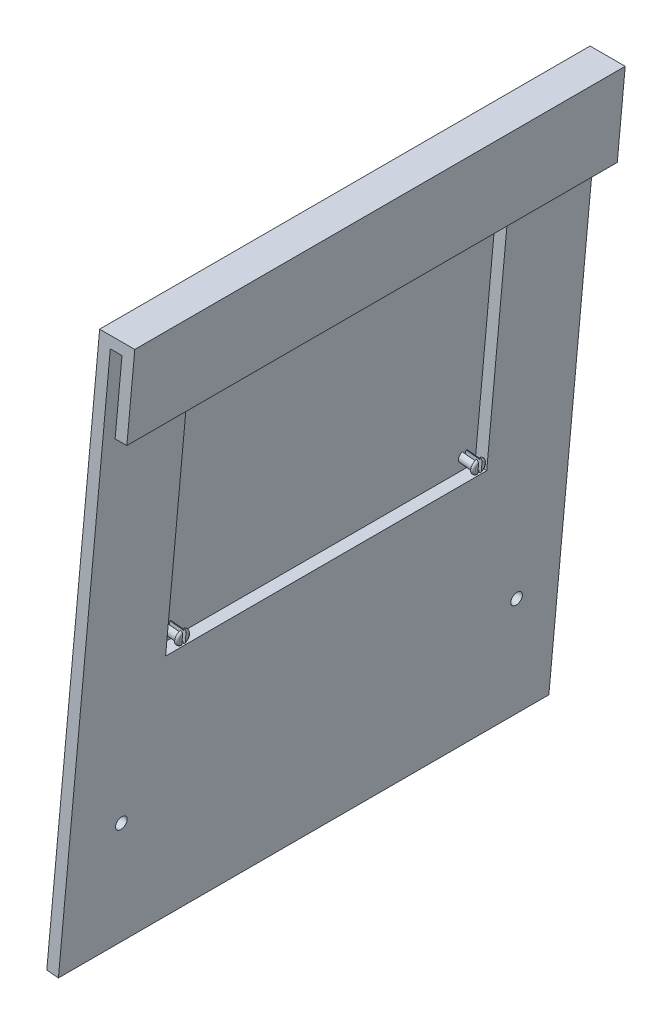
from build123d import *

# Parameters (mm, degrees)
CORTE_EXTRUS_O1_DEPTH      = 14
CORTE_EXTRUS_O1_DEPTH_BACK = 717.203128827
ESBO_O5_W                  = 275
ESBO_O5_H                  = 214
ESBO_O4_W                  = 300
ESBO_O4_H                  = 240
RESSALTO_EXTRUS_O1_DEPTH   = 15.25
ESBO_O6_R                  = 4.5
RESSALTO_EXTRUS_O2_DEPTH   = 12
ESBO_O7_R                  = 6
RESSALTO_EXTRUS_O3_DEPTH   = 2
FILETE1_R                  = 2
CORTE_EXTRUS_O2_REACH      = 717.754
ESBO_O8_W                  = 3
ESBO_O8_H                  = 13.7577121
ESBO_O8_H_2                = 16.639730047
ESBO_O8_H_3                = 15.770394444
ESBO_O8_H_4                = 13.946137119
CORTE_EXTRUS_O3_DEPTH      = 717.203128827
CORTE_EXTRUS_O3_DEPTH_BACK = 717.203128827
ESBO_O9_W                  = 197.593358125
ESBO_O9_H                  = 578.666263081
ESBO_O9_W_2                = 155.251924241
FILETE2_R                  = 5
SKETCH1_R                  = 5
CUT_EXTRUDE1_DEPTH         = 10
SKETCH2_R                  = 5
CUT_EXTRUDE2_DEPTH         = 10
SKETCH3_R                  = 5
CUT_EXTRUDE3_DEPTH         = 10
SKETCH4_R                  = 5
CUT_EXTRUDE4_DEPTH         = 10


with BuildPart() as part:
    # Varredura2: sweep along a path in Esboço2
    with BuildLine(Plane(origin=(0, 550, 0), x_dir=(1, 0, 0), z_dir=(0, 1, 0))) as varredura2_path:
        Line((950, -255), (950, 255))
    # Esboço3 → Varredura2 (sweep)
    with BuildSketch(Plane.XY):
        Polygon((942.163647796, 573.800125755), (952.163647796, 573.800125755), (946.282557752, 509.10813527), (956.32379504, 509.10813527), (963.113975993, 583.800125755), (933.031501417, 583.800125755), (887.763628395, 85.853522521), (897.72256046, 84.948165061), align=None)
    sweep(path=varredura2_path.line)

    # Esboço5 → Corte-extrusão1 (cut, two sides: drawn at the far end of the back side and taken through both)
    with BuildSketch(Plane(origin=(872.745985968, -79.340544179, 0), x_dir=(0, 0, 1), z_dir=(-0.995893206467704, 0.09053574604251849, 0)).offset(-CORTE_EXTRUS_O1_DEPTH_BACK)):
        with Locations((0, 485.875282236)):
            Rectangle(ESBO_O5_W, ESBO_O5_H)
    extrude(amount=CORTE_EXTRUS_O1_DEPTH + CORTE_EXTRUS_O1_DEPTH_BACK, mode=Mode.SUBTRACT)

    # Esboço4 → Ressalto-extrusão1 (add)
    with BuildSketch(Plane(origin=(872.745985968, -79.340544179, 0), x_dir=(0, 0, 1), z_dir=(-0.995893206467704, 0.09053574604251849, 0))):
        with Locations((0, 485.875282236)):
            Rectangle(ESBO_O4_W, ESBO_O4_H)
    extrude(amount=RESSALTO_EXTRUS_O1_DEPTH)

    # Esboço6 → Ressalto-extrusão2 (add)
    with BuildSketch(Plane(origin=(872.745985968, -79.340544179, 0), x_dir=(0, 0, -1), z_dir=(0.995893206467704, -0.09053574604251843, 0))):
        with Locations(Location((-126.74, 389.535282236, 0), (0, 0, 90))):
            Circle(ESBO_O6_R)
        with Locations(Location((126.74, 389.535282236, 0), (0, 0, 270))):
            Circle(ESBO_O6_R)
        with Locations(Location((-126.74, 581.525282236, 0), (0, 0, 90))):
            Circle(ESBO_O6_R)
        with Locations(Location((126.74, 581.525282236, 0), (0, 0, 270))):
            Circle(ESBO_O6_R)
    extrude(amount=RESSALTO_EXTRUS_O2_DEPTH)

    # Esboço7 → Ressalto-extrusão3 (add)
    with BuildSketch(Plane(origin=(884.696704446, -80.426973131, 0), x_dir=(0, 0, -1), z_dir=(0.995893206467704, -0.09053574604251846, 0))):
        with Locations(Location((-126.74, 389.535282236, 0), (0, 0, 90))):
            Circle(ESBO_O7_R)
        with Locations(Location((126.74, 389.535282236, 0), (0, 0, 90))):
            Circle(ESBO_O7_R)
        with Locations(Location((126.74, 581.525282236, 0), (0, 0, 90))):
            Circle(ESBO_O7_R)
        with Locations(Location((-126.74, 581.525282236, 0), (0, 0, 90))):
            Circle(ESBO_O7_R)
    extrude(amount=RESSALTO_EXTRUS_O3_DEPTH)

    # Filete1
    filete1_edges = [part.edges().sort_by_distance(p)[0] for p in [
        (921.41214377, 301.352137396, -126.74),
        (938.794101652, 492.553674106, -126.74),
        (938.794101652, 492.553674106, 126.74),
        (921.41214377, 301.352137396, 126.74),
    ]]
    fillet(filete1_edges, radius=FILETE1_R - 0.0001)  # a hair under: the kernel refuses the full size

    # Corte-extrusão2: up to this face of the body (flat: up to its plane)
    corte_extrus_o2_end = Plane(part.part.faces().sort_by_distance((916.735202776, 404.540840706, 0))[0])
    # Esboço8 → Corte-extrusão2 (cut, up to the picked face)
    with BuildSketch(Plane(origin=(886.688490859, -80.608044624, 0), x_dir=(0, 0, -1), z_dir=(0.995893206467704, -0.09053574604251849, 0)), mode=Mode.PRIVATE) as corte_extrus_o2_sk1:
        with Locations((-126.74, 389.535282236)):
            Rectangle(ESBO_O8_W, ESBO_O8_H)
    corte_extrus_o2_tool1 = split(extrude(corte_extrus_o2_sk1.sketch, amount=-CORTE_EXTRUS_O2_REACH, mode=Mode.PRIVATE), bisect_by=corte_extrus_o2_end, keep=Keep.BOTH, mode=Mode.PRIVATE)
    # Esboço8 → Corte-extrusão2 (cut, up to the picked face)
    with BuildSketch(Plane(origin=(886.688490859, -80.608044624, 0), x_dir=(0, 0, -1), z_dir=(0.995893206467704, -0.09053574604251849, 0)), mode=Mode.PRIVATE) as corte_extrus_o2_sk2:
        with Locations((126.74, 389.535282237)):
            Rectangle(ESBO_O8_W, ESBO_O8_H_2)
    corte_extrus_o2_tool2 = split(extrude(corte_extrus_o2_sk2.sketch, amount=-CORTE_EXTRUS_O2_REACH, mode=Mode.PRIVATE), bisect_by=corte_extrus_o2_end, keep=Keep.BOTH, mode=Mode.PRIVATE)
    # Esboço8 → Corte-extrusão2 (cut, up to the picked face)
    with BuildSketch(Plane(origin=(886.688490859, -80.608044624, 0), x_dir=(0, 0, -1), z_dir=(0.995893206467704, -0.09053574604251849, 0)), mode=Mode.PRIVATE) as corte_extrus_o2_sk3:
        with Locations((126.74, 581.525282236)):
            Rectangle(ESBO_O8_W, ESBO_O8_H_3)
    corte_extrus_o2_tool3 = split(extrude(corte_extrus_o2_sk3.sketch, amount=-CORTE_EXTRUS_O2_REACH, mode=Mode.PRIVATE), bisect_by=corte_extrus_o2_end, keep=Keep.BOTH, mode=Mode.PRIVATE)
    # Esboço8 → Corte-extrusão2 (cut, up to the picked face)
    with BuildSketch(Plane(origin=(886.688490859, -80.608044624, 0), x_dir=(0, 0, -1), z_dir=(0.995893206467704, -0.09053574604251849, 0)), mode=Mode.PRIVATE) as corte_extrus_o2_sk4:
        with Locations((-126.74, 581.525282237)):
            Rectangle(ESBO_O8_W, ESBO_O8_H_4)
    corte_extrus_o2_tool4 = split(extrude(corte_extrus_o2_sk4.sketch, amount=-CORTE_EXTRUS_O2_REACH, mode=Mode.PRIVATE), bisect_by=corte_extrus_o2_end, keep=Keep.BOTH, mode=Mode.PRIVATE)
    add(corte_extrus_o2_tool1.solids().sort_by(Axis((921.955358, 307.327497, 126.74), (-0.995893206467704, 0.09053574604251849, 0)))[0], mode=Mode.SUBTRACT)
    add(corte_extrus_o2_tool2.solids().sort_by(Axis((921.955358, 307.327497, -126.74), (-0.995893206467704, 0.09053574604251849, 0)))[0], mode=Mode.SUBTRACT)
    add(corte_extrus_o2_tool3.solids().sort_by(Axis((939.337316, 498.529033, -126.74), (-0.995893206467704, 0.09053574604251849, 0)))[0], mode=Mode.SUBTRACT)
    add(corte_extrus_o2_tool4.solids().sort_by(Axis((939.337316, 498.529033, 126.74), (-0.995893206467704, 0.09053574604251849, 0)))[0], mode=Mode.SUBTRACT)

    # Esboço9 → Corte-extrusão3 (cut, two sides: drawn at the far end of the back side and taken through both)
    with BuildSketch(Plane(origin=(872.745985968, -79.340544179, 0), x_dir=(0, 0, 1), z_dir=(-0.995893206467704, 0.09053574604251848, 0)).offset(-CORTE_EXTRUS_O3_DEPTH_BACK)):
        with Locations((-308.796679063, 425.106968151)):
            Rectangle(ESBO_O9_W, ESBO_O9_H)
        with Locations((287.625962121, 425.106968151)):
            Rectangle(ESBO_O9_W_2, ESBO_O9_H)
    extrude(amount=CORTE_EXTRUS_O3_DEPTH + CORTE_EXTRUS_O3_DEPTH_BACK, mode=Mode.SUBTRACT)

    # Filete2
    filete2_edges = [part.edges().sort_by_distance(p)[0] for p in [
        (916.735067129, 404.539348591, 150),
        (927.599356654, 524.046533367, 0),
        (916.735067129, 404.539348591, -150),
        (905.870777604, 285.032163815, 0),
    ]]
    fillet(filete2_edges, radius=FILETE2_R)

    # Sketch1 → Cut-Extrude1 (cut)
    with BuildSketch(Plane(origin=(872.745985968, -79.340544179, 0), x_dir=(0, 0, 1), z_dir=(-0.995893206467704, 0.09053574604251848, 0))):
        with Locations(Location((-175.063670352, 629.979964554, 0), (0, 0, 270))):
            Circle(SKETCH1_R)
    extrude(amount=-CUT_EXTRUDE1_DEPTH, mode=Mode.SUBTRACT)

    # Sketch2 → Cut-Extrude2 (cut)
    with BuildSketch(Plane(origin=(872.745985968, -79.340544179, 0), x_dir=(0, 0, 1), z_dir=(-0.995893206467704, 0.09053574604251848, 0))):
        with Locations(Location((174.924038487, 629.587833095, 0), (0, 0, 270))):
            Circle(SKETCH2_R)
    extrude(amount=-CUT_EXTRUDE2_DEPTH, mode=Mode.SUBTRACT)

    # Sketch3 → Cut-Extrude3 (cut)
    with BuildSketch(Plane(origin=(872.745985968, -79.340544179, 0), x_dir=(0, 0, 1), z_dir=(-0.995893206467704, 0.09053574604251848, 0))):
        with Locations(Location((164.911312449, 263.002833137, 0), (0, 0, 270))):
            Circle(SKETCH3_R)
    extrude(amount=-CUT_EXTRUDE3_DEPTH, mode=Mode.SUBTRACT)

    # Sketch4 → Cut-Extrude4 (cut)
    with BuildSketch(Plane(origin=(872.745985968, -79.340544179, 0), x_dir=(0, 0, 1), z_dir=(-0.995893206467704, 0.09053574604251848, 0))):
        with Locations(Location((-173.869916072, 259.873321475, 0), (0, 0, 270))):
            Circle(SKETCH4_R)
    extrude(amount=-CUT_EXTRUDE4_DEPTH, mode=Mode.SUBTRACT)


solid = part.part
